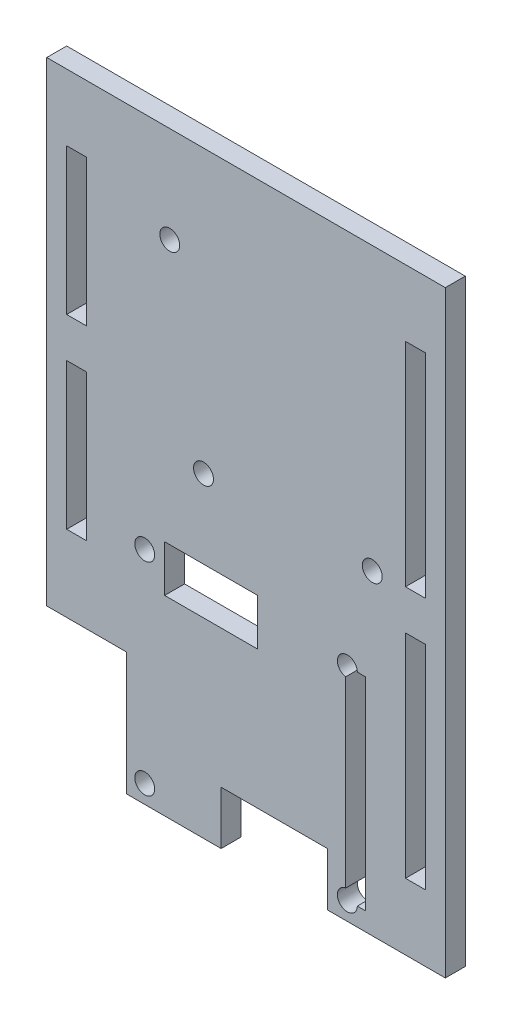
from build123d import *

# Parameters (mm, degrees)
SKETCH1_W           = 60
SKETCH1_H           = 90
BOSS_EXTRUDE1_DEPTH = 3
SKETCH3_R           = 1.5
CUT_EXTRUDE2_DEPTH  = 3
SKETCH4_R           = 1.5
CUT_EXTRUDE3_DEPTH  = 55.166410256
SKETCH5_W           = 3
SKETCH5_H           = 32
CUT_EXTRUDE4_DEPTH  = 55.166410256
SKETCH6_W           = 3
SKETCH6_H           = 22
CUT_EXTRUDE5_DEPTH  = 55.166410256
SKETCH7_W           = 3
SKETCH7_H           = 30.5
SKETCH7_W_2         = 14
SKETCH7_H_2         = 7
SKETCH7_W_3         = 16
SKETCH7_H_3         = 8
CUT_EXTRUDE6_DEPTH  = 55.166410256
SKETCH8_W           = 12
SKETCH8_H           = 18.5
CUT_EXTRUDE7_DEPTH  = 55.166410256


with BuildPart() as part:
    # Sketch1 → Boss-Extrude1 (new body)
    with BuildSketch(Plane.XY):
        Rectangle(SKETCH1_W, SKETCH1_H)
    extrude(amount=-BOSS_EXTRUDE1_DEPTH)

    # Sketch3 → Cut-Extrude2 (cut)
    with BuildSketch(Plane.XY):
        with Locations((-11.48, 30.5)):
            Circle(SKETCH3_R)
        with Locations((-6.4, 2.56)):
            Circle(SKETCH3_R)
        with Locations((19, 2.56)):
            Circle(SKETCH3_R)
    extrude(amount=-CUT_EXTRUDE2_DEPTH, mode=Mode.SUBTRACT)

    # Sketch4 → Cut-Extrude3 (cut, through all)
    with BuildSketch(Plane.XY):
        with Locations((-15.25, -42.25)):
            Circle(SKETCH4_R)
        with Locations((-15.25, -11.75)):
            Circle(SKETCH4_R)
        with Locations((15.25, -42.25)):
            Circle(SKETCH4_R)
        with Locations((15.25, -11.75)):
            Circle(SKETCH4_R)
    extrude(amount=-CUT_EXTRUDE3_DEPTH, mode=Mode.SUBTRACT)

    # Sketch5 → Cut-Extrude4 (cut, through all)
    with BuildSketch(Plane.XY):
        with Locations((25.5, -19)):
            Rectangle(SKETCH5_W, SKETCH5_H)
        with Locations((25.5, 19)):
            Rectangle(SKETCH5_W, SKETCH5_H)
    extrude(amount=-CUT_EXTRUDE4_DEPTH, mode=Mode.SUBTRACT)

    # Sketch6 → Cut-Extrude5 (cut, through all)
    with BuildSketch(Plane.XY):
        with Locations((-25.5, -4)):
            Rectangle(SKETCH6_W, SKETCH6_H)
        with Locations((-25.5, 24)):
            Rectangle(SKETCH6_W, SKETCH6_H)
    extrude(amount=-CUT_EXTRUDE5_DEPTH, mode=Mode.SUBTRACT)

    # Sketch7 → Cut-Extrude6 (cut, through all)
    with BuildSketch(Plane.XY):
        with Locations((16.5, -27)):
            Rectangle(SKETCH7_W, SKETCH7_H)
        with Locations((-5.25, -12.75)):
            Rectangle(SKETCH7_W_2, SKETCH7_H_2)
        with Locations((4.25, -41)):
            Rectangle(SKETCH7_W_3, SKETCH7_H_3)
    extrude(amount=-CUT_EXTRUDE6_DEPTH, mode=Mode.SUBTRACT)

    # Sketch8 → Cut-Extrude7 (cut, through all)
    with BuildSketch(Plane.XY):
        with Locations((-24, -35.75)):
            Rectangle(SKETCH8_W, SKETCH8_H)
    extrude(amount=-CUT_EXTRUDE7_DEPTH, mode=Mode.SUBTRACT)


solid = part.part
